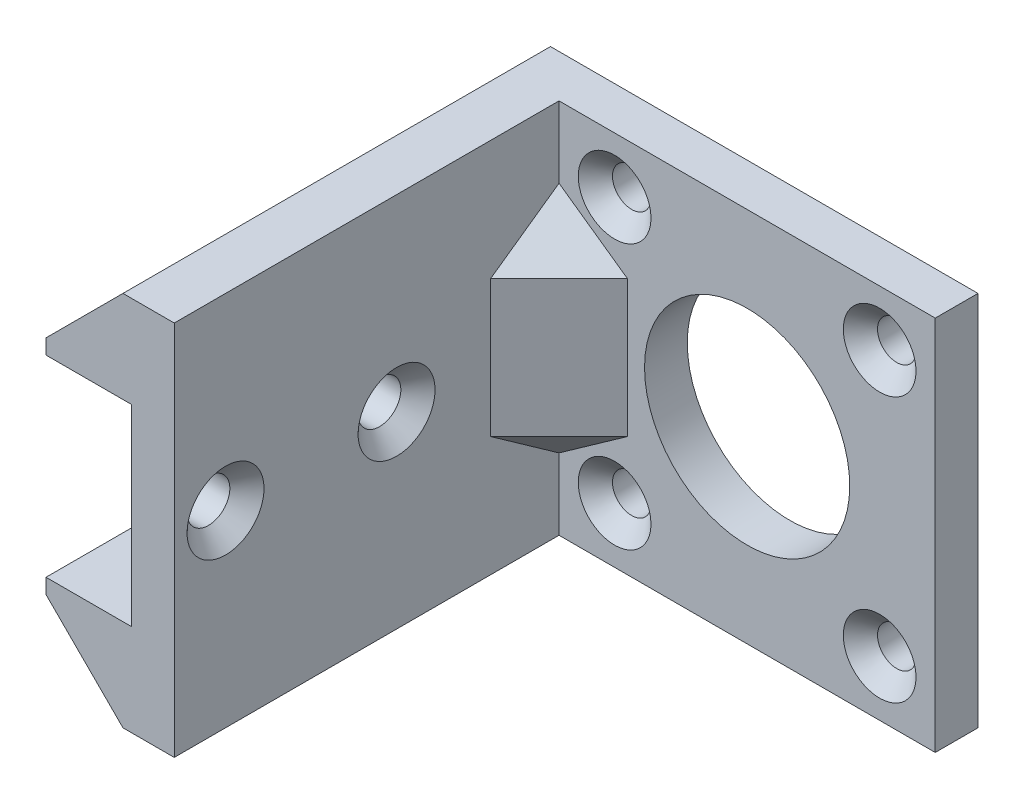
from build123d import *

# Parameters (mm, degrees)
SKETCH1_W           = 44
SKETCH1_H           = 44
SKETCH1_R           = 2.25
SKETCH1_R_2         = 12
BOSS_EXTRUDE1_DEPTH = 5
SKETCH2_W           = 50
SKETCH2_H           = 44
SKETCH2_R           = 2.5
BOSS_EXTRUDE2_DEPTH = 5
BOSS_EXTRUDE3_DEPTH = 15
CHAMFER1_SIZE       = 7
CHAMFER2_SIZE       = 2
SKETCH4_W           = 50
SKETCH4_H           = 10.75
BOSS_EXTRUDE4_DEPTH = 10
CHAMFER3_SIZE       = 9
CHAMFER4_SIZE       = 2


with BuildPart() as part:
    # Sketch1 → Boss-Extrude1 (new body)
    with BuildSketch(Plane.XY):
        Rectangle(SKETCH1_W, SKETCH1_H)
        with Locations((15.5, 15.5)):
            Circle(SKETCH1_R, mode=Mode.SUBTRACT)
        with Locations((15.5, -15.5)):
            Circle(SKETCH1_R, mode=Mode.SUBTRACT)
        with Locations((-15.5, -15.5)):
            Circle(SKETCH1_R, mode=Mode.SUBTRACT)
        with Locations((-15.5, 15.5)):
            Circle(SKETCH1_R, mode=Mode.SUBTRACT)
        Circle(SKETCH1_R_2, mode=Mode.SUBTRACT)
    extrude(amount=BOSS_EXTRUDE1_DEPTH)

    # Sketch2 → Boss-Extrude2 (add)
    with BuildSketch(Plane.ZY.offset(22)):
        with Locations((25, 0)):
            Rectangle(SKETCH2_W, SKETCH2_H)
        with Locations(Location((44, 0, 0), (0, 0, 270))):
            Circle(SKETCH2_R, mode=Mode.SUBTRACT)
        with Locations(Location((24, 0, 0), (0, 0, 270))):
            Circle(SKETCH2_R, mode=Mode.SUBTRACT)
    extrude(amount=BOSS_EXTRUDE2_DEPTH)

    # Sketch3 → Boss-Extrude3 (add, symmetric)
    with BuildSketch(Plane(origin=(0, 0, 0), x_dir=(1, 0, 0), z_dir=(0, 1, 0))):
        Polygon((-14, -5), (-22, -13), (-22, -5), align=None)
    extrude(amount=BOSS_EXTRUDE3_DEPTH, both=True)

    # Chamfer1
    # the kernel refuses this chamfer: 7 mm, written as the material it takes off along each edge
    with BuildSketch(Plane(origin=(-1.270818641, -15, -7.729181359), x_dir=(-0.7068394360706735, -0.02749587661058637, -0.7068394360706736), z_dir=(-0.7071067811865477, 0, 0.7071067811865475))) as chamfer1_piece_1_section:
        Polygon((CHAMFER1_SIZE * 0.999621916911, -CHAMFER1_SIZE * 0.0274958766106), (-CHAMFER1_SIZE * 0.0274958766106, -CHAMFER1_SIZE * 0.999621916911), (0, 0), align=None)
    chamfer1_piece_1 = extrude(amount=47.317270331, mode=Mode.PRIVATE)
    chamfer1_piece_1 = split(chamfer1_piece_1, bisect_by=Plane(origin=(-22, -12.156184448, 8.014329888), z_dir=(1, 0, 0)), keep=Keep.TOP, mode=Mode.PRIVATE)
    chamfer1_piece_1 = split(chamfer1_piece_1, bisect_by=Plane(origin=(-19.249817179, -12.156184448, 5), z_dir=(0, 0, 1)), keep=Keep.TOP, mode=Mode.PRIVATE)
    add(chamfer1_piece_1, mode=Mode.SUBTRACT)
    with BuildSketch(Plane(origin=(-1.270818641, 15, -7.729181359), x_dir=(0.019442520806014066, -0.9996219169112968, 0.019442520806014073), z_dir=(-0.7071067811865477, 0, 0.7071067811865475))) as chamfer1_piece_2_section:
        Polygon((CHAMFER1_SIZE * 0.999621916911, -CHAMFER1_SIZE * 0.0274958766106), (-CHAMFER1_SIZE * 0.0274958766106, -CHAMFER1_SIZE * 0.999621916911), (0, 0), align=None)
    chamfer1_piece_2 = extrude(amount=47.317270331, mode=Mode.PRIVATE)
    chamfer1_piece_2 = split(chamfer1_piece_2, bisect_by=Plane(origin=(-22, 12.156184448, 8.014329888), z_dir=(1, 0, 0)), keep=Keep.TOP, mode=Mode.PRIVATE)
    chamfer1_piece_2 = split(chamfer1_piece_2, bisect_by=Plane(origin=(-19.249817179, 12.156184448, 5), z_dir=(0, 0, 1)), keep=Keep.TOP, mode=Mode.PRIVATE)
    add(chamfer1_piece_2, mode=Mode.SUBTRACT)

    # Chamfer2
    chamfer2_edges = [part.edges().sort_by_distance(p)[0] for p in [
        (-22, 2.5, 44),
        (-22, 2.5, 24),
    ]]
    chamfer(chamfer2_edges, length=CHAMFER2_SIZE)

    # Sketch4 → Boss-Extrude4 (add)
    with BuildSketch(Plane.ZY.offset(27)):
        with Locations((25, 16.625)):
            Rectangle(SKETCH4_W, SKETCH4_H)
        with Locations((25, -16.625)):
            Rectangle(SKETCH4_W, SKETCH4_H)
    extrude(amount=BOSS_EXTRUDE4_DEPTH)

    # Chamfer3
    chamfer3_edges = [part.edges().sort_by_distance(p)[0] for p in [
        (-37, -22, 25),
        (-37, 22, 25),
    ]]
    chamfer(chamfer3_edges, length=CHAMFER3_SIZE)

    # Chamfer4
    chamfer4_edges = [part.edges().sort_by_distance(p)[0] for p in [
        (13.25, 15.5, 5),
        (13.25, -15.5, 5),
        (-17.75, 15.5, 5),
        (-17.75, -15.5, 5),
    ]]
    chamfer(chamfer4_edges, length=CHAMFER4_SIZE)


solid = part.part
